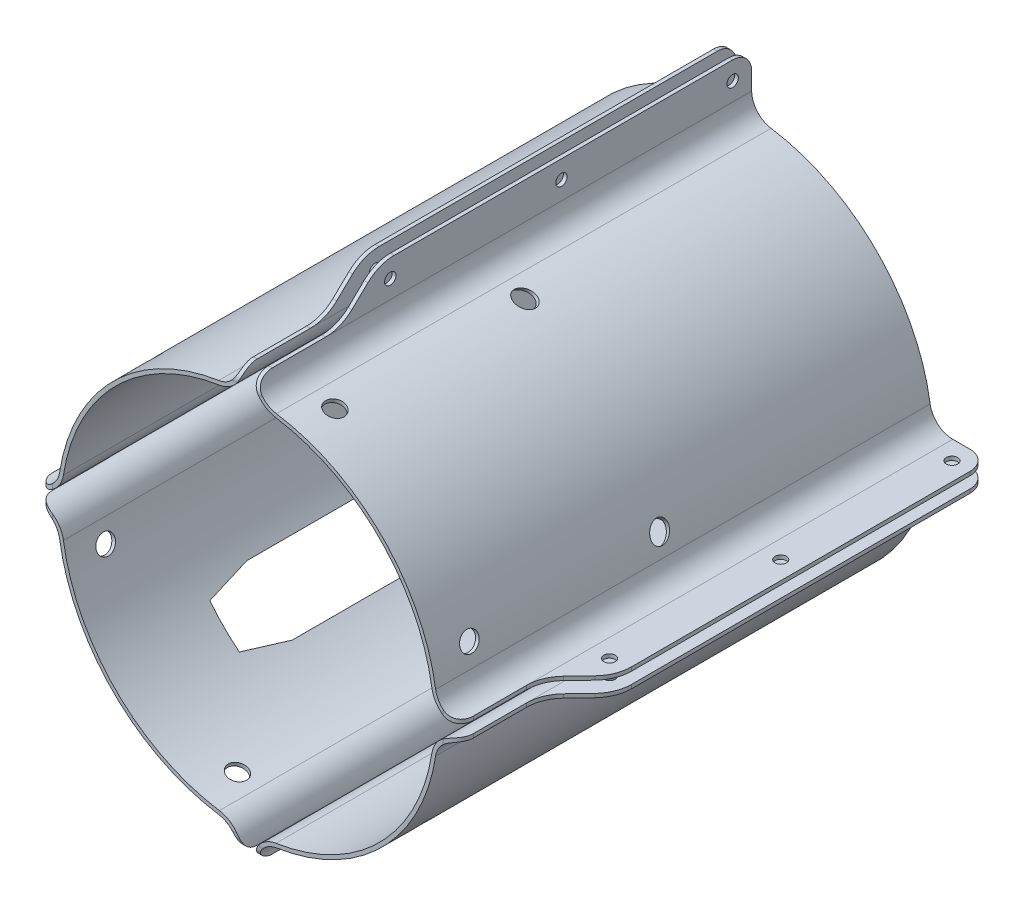
from build123d import *

# Parameters (mm, degrees)
EXTRUDE_1_DEPTH          = 130
EXTRUDE_1_2_DEPTH        = 130
EXTRUDE_1_3_DEPTH        = 130
EXTRUDE_1_4_DEPTH        = 130
SKETCH_2_R               = 1.5
CUT_EXTRUDE_1_DEPTH      = 130
FILLET_1_R               = 4
FILLET_2_R               = 4
FILLET_5_R               = 10
FILLET_6_R               = 10
FILLET_7_R               = 5
FILLET_8_R               = 5
CUT_EXTRUDE_START        = -5
SKETCH_3_R               = 1.5
CUT_EXTRUDE_2_DEPTH      = 5
PATTERN_CIRCULAR_6_COUNT = 4
FILLET_9_R               = 4
FILLET_10_R              = 10
FILLET_11_R              = 5
FILLET_12_R              = 5
FILLET_13_R              = 4
FILLET_14_R              = 10
FILLET_15_R              = 5
FILLET_16_R              = 5
FILLET_17_R              = 10
FILLET_18_R              = 10
FILLET_19_R              = 4
FILLET_20_R              = 10
FILLET_21_R              = 4
SKETCH_4_R               = 2.5
CUT_EXTRUDE_3_DEPTH      = 160.165786774
PATTERN_CIRCULAR_7_COUNT = 6
SKETCH_6_W               = 17
SKETCH_6_H               = 63.5
CUT_EXTRUDE_4_DEPTH      = 160.352163115
SKETCH_7_R               = 2.5
CUT_EXTRUDE_5_DEPTH      = 72


with BuildPart() as part:
    # Эскиз1 → Бобышка-Вытянуть1 (new body)
    with BuildSketch(Plane.XY):
        with BuildLine():
            Line((2.5, 55.35115175), (2.5, 64.937460889))
            Line((2.5, 64.937460889), (1.5, 64.937460889))
            Line((1.5, 64.937460889), (1.5, 55.35115175))
            ThreePointArc((1.5, 55.35115175), (3.18786766, 50.792506117), (7.4375, 48.432257781))
            ThreePointArc((7.4375, 48.432257781), (34.648232278, 34.648232278), (48.432257781, 7.4375))
            ThreePointArc((48.432257781, 7.4375), (50.792506117, 3.18786766), (55.35115175, 1.5))
            Line((55.35115175, 1.5), (64.937460889, 1.5))
            Line((64.937460889, 1.5), (64.937460889, 2.5))
            Line((64.937460889, 2.5), (55.35115175, 2.5))
            ThreePointArc((55.35115175, 2.5), (51.443741208, 3.946743708), (49.420671205, 7.589285714))
            ThreePointArc((49.420671205, 7.589285714), (35.355339059, 35.355339059), (7.589285714, 49.420671205))
            ThreePointArc((7.589285714, 49.420671205), (3.946743708, 51.443741208), (2.5, 55.35115175))
        make_face()
    extrude(amount=EXTRUDE_1_DEPTH)


with BuildPart() as body_2:
    # Эскиз1 → Extrude 1 2 (new body)
    with BuildSketch(Plane.XY):
        with BuildLine():
            Line((-1.5, 64.937460889), (-2.5, 64.937460889))
            Line((-2.5, 64.937460889), (-2.5, 55.35115175))
            ThreePointArc((-2.5, 55.35115175), (-3.946743708, 51.443741208), (-7.589285714, 49.420671205))
            ThreePointArc((-7.589285714, 49.420671205), (-35.355339059, 35.355339059), (-49.420671205, 7.589285714))
            ThreePointArc((-49.420671205, 7.589285714), (-51.443741208, 3.946743708), (-55.35115175, 2.5))
            Line((-55.35115175, 2.5), (-64.937460889, 2.5))
            Line((-64.937460889, 2.5), (-64.937460889, 1.5))
            Line((-64.937460889, 1.5), (-55.35115175, 1.5))
            ThreePointArc((-55.35115175, 1.5), (-50.792506117, 3.18786766), (-48.432257781, 7.4375))
            ThreePointArc((-48.432257781, 7.4375), (-34.648232278, 34.648232278), (-7.4375, 48.432257781))
            ThreePointArc((-7.4375, 48.432257781), (-3.18786766, 50.792506117), (-1.5, 55.35115175))
            Line((-1.5, 55.35115175), (-1.5, 64.937460889))
        make_face()
    extrude(amount=EXTRUDE_1_2_DEPTH)


with BuildPart() as body_3:
    # Эскиз1 → Extrude 1 3 (new body)
    with BuildSketch(Plane.XY):
        with BuildLine():
            Line((55.35115175, -2.5), (64.937460889, -2.5))
            Line((64.937460889, -2.5), (64.937460889, -1.5))
            Line((64.937460889, -1.5), (55.35115175, -1.5))
            ThreePointArc((55.35115175, -1.5), (50.792506117, -3.18786766), (48.432257781, -7.4375))
            ThreePointArc((48.432257781, -7.4375), (34.648232278, -34.648232278), (7.4375, -48.432257781))
            ThreePointArc((7.4375, -48.432257781), (3.18786766, -50.792506117), (1.5, -55.35115175))
            Line((1.5, -55.35115175), (1.5, -64.937460889))
            Line((1.5, -64.937460889), (2.5, -64.937460889))
            Line((2.5, -64.937460889), (2.5, -55.35115175))
            ThreePointArc((2.5, -55.35115175), (3.946743708, -51.443741208), (7.589285714, -49.420671205))
            ThreePointArc((7.589285714, -49.420671205), (35.355339059, -35.355339059), (49.420671205, -7.589285714))
            ThreePointArc((49.420671205, -7.589285714), (51.443741208, -3.946743708), (55.35115175, -2.5))
        make_face()
    extrude(amount=EXTRUDE_1_3_DEPTH)


with BuildPart() as body_4:
    # Эскиз1 → Extrude 1 4 (new body)
    with BuildSketch(Plane.XY):
        with BuildLine():
            Line((-2.5, -55.35115175), (-2.5, -64.937460889))
            Line((-2.5, -64.937460889), (-1.5, -64.937460889))
            Line((-1.5, -64.937460889), (-1.5, -55.35115175))
            ThreePointArc((-1.5, -55.35115175), (-3.18786766, -50.792506117), (-7.4375, -48.432257781))
            ThreePointArc((-7.4375, -48.432257781), (-34.648232278, -34.648232278), (-48.432257781, -7.4375))
            ThreePointArc((-48.432257781, -7.4375), (-50.792506117, -3.18786766), (-55.35115175, -1.5))
            Line((-55.35115175, -1.5), (-64.937460889, -1.5))
            Line((-64.937460889, -1.5), (-64.937460889, -2.5))
            Line((-64.937460889, -2.5), (-55.35115175, -2.5))
            ThreePointArc((-55.35115175, -2.5), (-51.443741208, -3.946743708), (-49.420671205, -7.589285714))
            ThreePointArc((-49.420671205, -7.589285714), (-35.355339059, -35.355339059), (-7.589285714, -49.420671205))
            ThreePointArc((-7.589285714, -49.420671205), (-3.946743708, -51.443741208), (-2.5, -55.35115175))
        make_face()
    extrude(amount=EXTRUDE_1_4_DEPTH)


with BuildPart() as cut_extrude_1_tool:
    # Эскиз2 → Вырез-Вытянуть1 (new body)
    with BuildSketch(Plane(origin=(2.5, 0, 0), x_dir=(0, 0, -1), z_dir=(1, 0, 0))):
        with Locations((-5, 60.144306319)):
            Circle(SKETCH_2_R)
        with Locations((-50, 60.144306319)):
            Circle(SKETCH_2_R)
        with Locations((-95, 60.144306319)):
            Circle(SKETCH_2_R)
        Polygon((-130, 64.937460889), (-98, 64.937460889), (-108, 55.35115175), (-130, 55.35115175), align=None)
    extrude(amount=-CUT_EXTRUDE_1_DEPTH)


with BuildPart() as part_1:
    add(part.part)

    # Вырез-Вытянуть1: cut by cut_extrude_1_tool
    add(cut_extrude_1_tool.part, mode=Mode.SUBTRACT)

    # Скругление1
    # the kernel refuses this fillet: 4 mm, written as the material it takes off along each edge
    with BuildSketch(Plane(origin=(12.5, 55.35115175, 130), x_dir=(0, 0, -1), z_dir=(-1, 0, 0))) as fillet_1_piece_1:
        with BuildLine():
            CenterArc((FILLET_1_R, FILLET_1_R), FILLET_1_R, 180, 90)
            Line((0, FILLET_1_R), (0, 0))
            Line((0, 0), (FILLET_1_R, 0))
        make_face()
    extrude(amount=21, mode=Mode.SUBTRACT)

    # Скругление6
    fillet_6_edges = [part_1.edges().sort_by_distance(p)[0] for p in [
        (2, 64.937460889, 98),
    ]]
    fillet(fillet_6_edges, radius=FILLET_6_R)

    # Скругление8
    fillet_8_edges = [part_1.edges().sort_by_distance(p)[0] for p in [
        (2, 64.937460889, 0),
    ]]
    fillet(fillet_8_edges, radius=FILLET_8_R)


with BuildPart() as body_2_1:
    add(body_2.part)

    # Вырез-Вытянуть1: cut by cut_extrude_1_tool
    add(cut_extrude_1_tool.part, mode=Mode.SUBTRACT)

    # Скругление2
    # the kernel refuses this fillet: 4 mm, written as the material it takes off along each edge
    with BuildSketch(Plane(origin=(8.5, 55.35115175, 130), x_dir=(0, 0, -1), z_dir=(-1, 0, 0))) as fillet_2_piece_1:
        with BuildLine():
            CenterArc((FILLET_2_R, FILLET_2_R), FILLET_2_R, 180, 90)
            Line((0, FILLET_2_R), (0, 0))
            Line((0, 0), (FILLET_2_R, 0))
        make_face()
    extrude(amount=21, mode=Mode.SUBTRACT)

    # Скругление5
    fillet_5_edges = [body_2_1.edges().sort_by_distance(p)[0] for p in [
        (-2, 64.937460889, 98),
    ]]
    fillet(fillet_5_edges, radius=FILLET_5_R)

    # Скругление7
    fillet_7_edges = [body_2_1.edges().sort_by_distance(p)[0] for p in [
        (-2, 64.937460889, 0),
    ]]
    fillet(fillet_7_edges, radius=FILLET_7_R)


with BuildPart() as cut_extrude_2_tool:
    # Эскиз3 → Вырез-Вытянуть2 (new body)
    with BuildSketch(Plane(origin=(0, 2.5, 0), x_dir=(1, 0, 0), z_dir=(0, 1, 0)).offset(CUT_EXTRUDE_START)):
        with Locations(Location((-60.144306319, -5, 0), (0, 0, 180))):
            Circle(SKETCH_3_R)
        with Locations(Location((-60.144306319, -50, 0), (0, 0, 180))):
            Circle(SKETCH_3_R)
        with Locations(Location((-60.144306319, -95, 0), (0, 0, 180))):
            Circle(SKETCH_3_R)
        Polygon((-64.937460889, -130), (-64.937460889, -98), (-55.35115175, -108), (-55.35115175, -130), align=None)
    cut_extrude_2 = extrude(amount=CUT_EXTRUDE_2_DEPTH)


with BuildPart() as body_2_2:
    add(body_2_1.part)

    # Вырез-Вытянуть2: cut by cut_extrude_2_tool
    add(cut_extrude_2_tool.part, mode=Mode.SUBTRACT)

    # Скругление9
    # the kernel refuses this fillet: 4 mm, written as the material it takes off along each edge
    with BuildSketch(Plane(origin=(-55.35115175, -8.5, 130), x_dir=(1, 0, 0), z_dir=(0, 1, 0))) as fillet_9_piece_1:
        with BuildLine():
            CenterArc((FILLET_9_R, FILLET_9_R), FILLET_9_R, 180, 90)
            Line((0, FILLET_9_R), (0, 0))
            Line((0, 0), (FILLET_9_R, 0))
        make_face()
    extrude(amount=21, mode=Mode.SUBTRACT)

    # Скругление10
    fillet_10_edges = [body_2_2.edges().sort_by_distance(p)[0] for p in [
        (-64.937460889, 2, 98),
        (-55.35115175, 2, 108),
    ]]
    fillet(fillet_10_edges, radius=FILLET_10_R)

    # Скругление11
    fillet_11_edges = [body_2_2.edges().sort_by_distance(p)[0] for p in [
        (-64.937460889, 2, 0),
    ]]
    fillet(fillet_11_edges, radius=FILLET_11_R)

    # Скругление18
    fillet_18_edges = [body_2_2.edges().sort_by_distance(p)[0] for p in [
        (-2, 55.35115175, 108),
    ]]
    fillet(fillet_18_edges, radius=FILLET_18_R)


with BuildPart() as body_4_1:
    add(body_4.part)

    # Вырез-Вытянуть2: cut by cut_extrude_2_tool
    add(cut_extrude_2_tool.part, mode=Mode.SUBTRACT)


with BuildPart() as pattern_circular_6_tool:
    # Круговой массив6: Вырез-Вытянуть2 ×4 about axis
    pattern_circular_6_axis = Axis((0, 0, 130), (0, 0, -1))
    for i in range(1, PATTERN_CIRCULAR_6_COUNT):
        add(cut_extrude_2.rotate(pattern_circular_6_axis, i * 360 / PATTERN_CIRCULAR_6_COUNT))


with BuildPart() as part_2:
    add(part_1.part)

    # Круговой массив6: cut by pattern_circular_6_tool
    add(pattern_circular_6_tool.part, mode=Mode.SUBTRACT)

    # Скругление16
    fillet_16_edges = [part_2.edges().sort_by_distance(p)[0] for p in [
        (64.937460889, 2, 0),
    ]]
    fillet(fillet_16_edges, radius=FILLET_16_R)

    # Скругление17
    fillet_17_edges = [part_2.edges().sort_by_distance(p)[0] for p in [
        (64.937460889, 2, 98),
        (55.35115175, 2, 108),
        (2, 55.35115175, 108),
    ]]
    fillet(fillet_17_edges, radius=FILLET_17_R)

    # Скругление19
    # the kernel refuses this fillet: 4 mm, written as the material it takes off along each edge
    with BuildSketch(Plane(origin=(55.35115175, 12.5, 130), x_dir=(-1, 0, 0), z_dir=(0, -1, 0))) as fillet_19_piece_1:
        with BuildLine():
            CenterArc((FILLET_19_R, FILLET_19_R), FILLET_19_R, 180, 90)
            Line((0, FILLET_19_R), (0, 0))
            Line((0, 0), (FILLET_19_R, 0))
        make_face()
    extrude(amount=21, mode=Mode.SUBTRACT)


with BuildPart() as body_3_1:
    add(body_3.part)

    # Круговой массив6: cut by pattern_circular_6_tool
    add(pattern_circular_6_tool.part, mode=Mode.SUBTRACT)

    # Скругление15
    fillet_15_edges = [body_3_1.edges().sort_by_distance(p)[0] for p in [
        (2, -64.937460889, 0),
        (64.937460889, -2, 0),
    ]]
    fillet(fillet_15_edges, radius=FILLET_15_R)

    # Скругление20
    fillet_20_edges = [body_3_1.edges().sort_by_distance(p)[0] for p in [
        (64.937460889, -2, 98),
        (55.35115175, -2, 108),
        (2, -64.937460889, 98),
        (2, -55.35115175, 108),
    ]]
    fillet(fillet_20_edges, radius=FILLET_20_R)

    # Скругление21
    # the kernel refuses this fillet: 4 mm, written as the material it takes off along each edge
    with BuildSketch(Plane(origin=(55.35115175, 8.5, 130), x_dir=(-1, 0, 0), z_dir=(0, -1, 0))) as fillet_21_piece_1:
        with BuildLine():
            CenterArc((FILLET_21_R, FILLET_21_R), FILLET_21_R, 180, 90)
            Line((0, FILLET_21_R), (0, 0))
            Line((0, 0), (FILLET_21_R, 0))
        make_face()
    extrude(amount=21, mode=Mode.SUBTRACT)
    with BuildSketch(Plane(origin=(12.5, -55.35115175, 130), x_dir=(0, 0, -1), z_dir=(-1, 0, 0))) as fillet_21_piece_2:
        with BuildLine():
            CenterArc((FILLET_21_R, -FILLET_21_R), FILLET_21_R, 90, 90)
            Line((0, -FILLET_21_R), (0, 0))
            Line((0, 0), (FILLET_21_R, 0))
        make_face()
    extrude(amount=21, mode=Mode.SUBTRACT)

    # Эскиз4 → Вырез-Вытянуть3 (cut, through all)
    with BuildSketch(Plane(origin=(0, 0, 0), x_dir=(0.7071067811865477, 0.7071067811865475, 0), z_dir=(-0.7071067811865475, 0.7071067811865477, 0))):
        with Locations(Location((0, -120, 0), (0, 0, 180))):
            Circle(SKETCH_4_R)
    cut_extrude_3 = extrude(amount=-CUT_EXTRUDE_3_DEPTH, mode=Mode.SUBTRACT)


with BuildPart() as body_4_2:
    add(body_4_1.part)

    # Круговой массив6: cut by pattern_circular_6_tool
    add(pattern_circular_6_tool.part, mode=Mode.SUBTRACT)

    # Скругление12
    fillet_12_edges = [body_4_2.edges().sort_by_distance(p)[0] for p in [
        (-64.937460889, -2, 0),
        (-2, -64.937460889, 0),
    ]]
    fillet(fillet_12_edges, radius=FILLET_12_R)

    # Скругление13
    # the kernel refuses this fillet: 4 mm, written as the material it takes off along each edge
    with BuildSketch(Plane(origin=(8.5, -55.35115175, 130), x_dir=(0, 0, -1), z_dir=(-1, 0, 0))) as fillet_13_piece_1:
        with BuildLine():
            CenterArc((FILLET_13_R, -FILLET_13_R), FILLET_13_R, 90, 90)
            Line((0, -FILLET_13_R), (0, 0))
            Line((0, 0), (FILLET_13_R, 0))
        make_face()
    extrude(amount=21, mode=Mode.SUBTRACT)
    with BuildSketch(Plane(origin=(-55.35115175, -12.5, 130), x_dir=(1, 0, 0), z_dir=(0, 1, 0))) as fillet_13_piece_2:
        with BuildLine():
            CenterArc((FILLET_13_R, FILLET_13_R), FILLET_13_R, 180, 90)
            Line((0, FILLET_13_R), (0, 0))
            Line((0, 0), (FILLET_13_R, 0))
        make_face()
    extrude(amount=21, mode=Mode.SUBTRACT)

    # Скругление14
    fillet_14_edges = [body_4_2.edges().sort_by_distance(p)[0] for p in [
        (-2, -64.937460889, 98),
        (-2, -55.35115175, 108),
        (-64.937460889, -2, 98),
        (-55.35115175, -2, 108),
    ]]
    fillet(fillet_14_edges, radius=FILLET_14_R)


with BuildPart() as pattern_circular_7_tool:
    # Круговой массив7: Вырез-Вытянуть3 ×6 about axis
    pattern_circular_7_axis = Axis((0, 0, 130), (0, 0, -1))
    for i in range(1, PATTERN_CIRCULAR_7_COUNT):
        add(cut_extrude_3.rotate(pattern_circular_7_axis, i * 360 / PATTERN_CIRCULAR_7_COUNT))


with BuildPart() as part_3:
    add(part_2.part)

    # Круговой массив7: cut by pattern_circular_7_tool
    add(pattern_circular_7_tool.part, mode=Mode.SUBTRACT)

    # Эскиз7 → Вырез-Вытянуть5 (cut)
    with BuildSketch(Plane(origin=(-0.359651708, -0.096368385, 0), x_dir=(0.7071067811865517, -0.7071067811865434, 0), z_dir=(-0.7071067811865435, -0.7071067811865518, 0))):
        with Locations((25.186169423, 70)):
            Circle(SKETCH_7_R)
        with Locations((-24.813830577, 70)):
            Circle(SKETCH_7_R)
    extrude(amount=-CUT_EXTRUDE_5_DEPTH, mode=Mode.SUBTRACT)


with BuildPart() as body_2_3:
    add(body_2_2.part)

    # Круговой массив7: cut by pattern_circular_7_tool
    add(pattern_circular_7_tool.part, mode=Mode.SUBTRACT)


with BuildPart() as body_4_3:
    add(body_4_2.part)

    # Круговой массив7: cut by pattern_circular_7_tool
    add(pattern_circular_7_tool.part, mode=Mode.SUBTRACT)

    # Эскиз6 → Вырез-Вытянуть4 (cut, through all)
    with BuildSketch(Plane(origin=(-0.359651708, -0.096368385, 0), x_dir=(0.7071067811865517, -0.7071067811865434, 0), z_dir=(-0.7071067811865435, -0.7071067811865518, 0))):
        with Locations((0, 58.25)):
            Rectangle(SKETCH_6_W, SKETCH_6_H)
        Polygon((-5.5, 15), (-8.5, 26.5), (8.5, 26.5), (5.5, 15), align=None)
        Polygon((5.5, 101.5), (-5.5, 101.5), (-8.5, 90), (8.5, 90), align=None)
    extrude(amount=CUT_EXTRUDE_4_DEPTH, mode=Mode.SUBTRACT)


solid = Compound([body_3_1.part, part_3.part, body_2_3.part, body_4_3.part])
